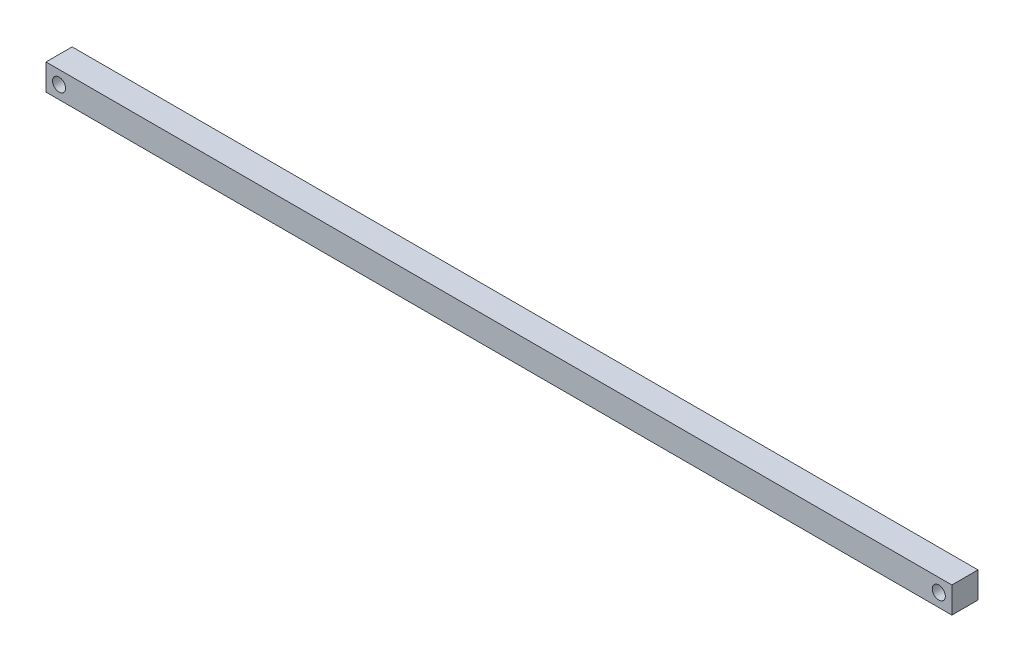
from build123d import *

# Parameters (mm, degrees)
SKETCH1_W           = 1040
SKETCH1_H           = 30
SKETCH1_R           = 7.5
BOSS_EXTRUDE1_DEPTH = 15


with BuildPart() as part:
    # Sketch1 → Boss-Extrude1 (new, symmetric)
    with BuildSketch(Plane.XY):
        Rectangle(SKETCH1_W, SKETCH1_H)
        with Locations((-505, 0)):
            Circle(SKETCH1_R, mode=Mode.SUBTRACT)
        with Locations((505, 0)):
            Circle(SKETCH1_R, mode=Mode.SUBTRACT)
    extrude(amount=BOSS_EXTRUDE1_DEPTH, both=True)


solid = part.part
